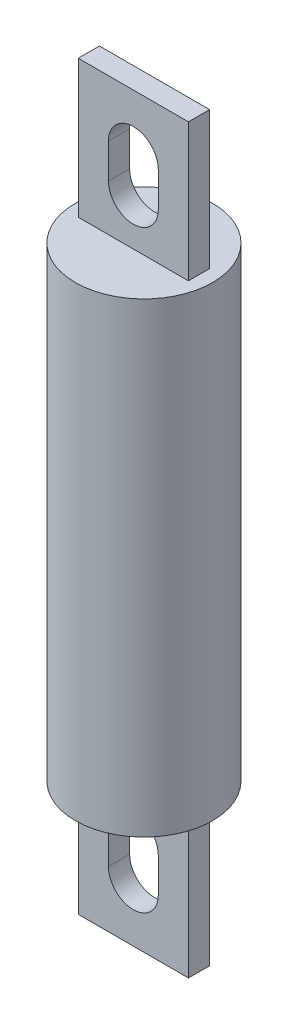
from build123d import *

# Parameters (mm, degrees)
SKETCH1_R           = 10.287
BOSS_EXTRUDE1_DEPTH = 69.85
SKETCH2_W           = 16.51
SKETCH2_H           = 3.175
BOSS_EXTRUDE2_DEPTH = 20.6375
CUT_EXTRUDE1_DEPTH  = 92.841242236


with BuildPart() as part:
    # Sketch1 → Boss-Extrude1 (new body)
    with BuildSketch(Plane(origin=(0, 0, 0), x_dir=(1, 0, 0), z_dir=(0, 1, 0))):
        Circle(SKETCH1_R)
    extrude(amount=BOSS_EXTRUDE1_DEPTH)

    # Sketch2 → Boss-Extrude2 (add)
    with BuildSketch(Plane(origin=(0, 69.85, 0), x_dir=(1, 0, 0), z_dir=(0, 1, 0))):
        Rectangle(SKETCH2_W, SKETCH2_H)
    boss_extrude2 = extrude(amount=BOSS_EXTRUDE2_DEPTH)

    # Sketch3 → Cut-Extrude1 (cut, through all)
    with BuildSketch(Plane.XY.offset(1.5875)):
        with BuildLine():
            Line((3.7338, 82.0166), (3.7338, 76.8096))
            ThreePointArc((3.7338, 76.8096), (0, 73.0758), (-3.7338, 76.8096))
            Line((-3.7338, 76.8096), (-3.7338, 82.0166))
            ThreePointArc((-3.7338, 82.0166), (0, 85.7504), (3.7338, 82.0166))
        make_face()
    cut_extrude1 = extrude(amount=-CUT_EXTRUDE1_DEPTH, mode=Mode.SUBTRACT)

    # Mirror2: Boss-Extrude2, Cut-Extrude1 across plane
    add(boss_extrude2.mirror(Plane.ZX.offset(34.925)))
    add(cut_extrude1.mirror(Plane.ZX.offset(34.925)), mode=Mode.SUBTRACT)


solid = part.part
